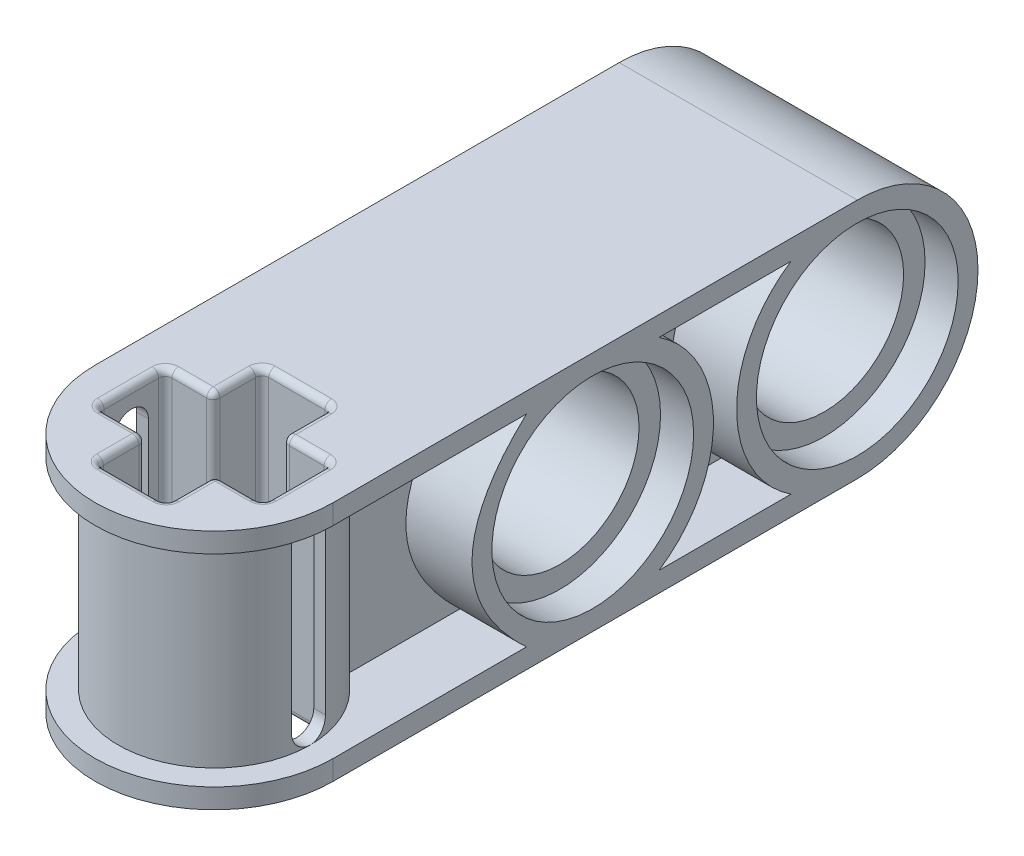
from build123d import *

# Parameters (mm, degrees)
SKETCH2_R           = 2.4
BOSS_EXTRUDE1_DEPTH = 7.2
CUT_EXTRUDE1_DEPTH  = 23.341721062
CUT_EXTRUDE2_START  = -7.3
CUT_EXTRUDE2_DEPTH  = 7.3
SKETCH5_R           = 3.05
CUT_EXTRUDE3_DEPTH  = 1
CUT_EXTRUDE4_START  = -1
SKETCH6_R           = 3.05
CUT_EXTRUDE4_DEPTH  = 1
CUT_EXTRUDE5_START  = -2
CUT_EXTRUDE5_DEPTH  = 2
CUT_EXTRUDE6_DEPTH  = 2
CUT_EXTRUDE10_DEPTH = 2
SKETCH13_W          = 1.9505477
SKETCH13_H          = 6.1
CUT_REVOLVE2_ANGLE  = 180
SKETCH13_3_W        = 1.9505477
SKETCH13_3_H        = 6.1
CUT_REVOLVE3_ANGLE  = 55
CUT_EXTRUDE11_DEPTH = 100
FILLET1_R           = 0.2


# Read off the part's stored shape, not the designer's step: Cut-Extrude2
with BuildPart() as part:
    # Sketch2 → Boss-Extrude1 (new body)
    with BuildSketch(Plane(origin=(0, 0, 0), x_dir=(0, 0, -1), z_dir=(1, 0, 0))):
        with BuildLine():
            Line((0, -3.65), (-19.85, -3.65))
            Line((-19.85, -3.65), (-19.85, 3.65))
            Line((-19.85, 3.65), (0, 3.65))
            ThreePointArc((0, 3.65), (3.65, 0), (0, -3.65))
        make_face()
        Circle(SKETCH2_R, mode=Mode.SUBTRACT)
        with Locations((-8, 0)):
            Circle(SKETCH2_R, mode=Mode.SUBTRACT)
    extrude(amount=BOSS_EXTRUDE1_DEPTH)

    # Sketch3 → Cut-Extrude1 (cut, through all)
    with BuildSketch(Plane(origin=(0, 3.65, 0), x_dir=(1, 0, 0), z_dir=(0, 1, 0))):
        Polygon((2.55, -14.825), (1.1, -14.825), (1.1, -16.875), (2.55, -16.875), (2.55, -18.35), (4.65, -18.35), (4.65, -16.875), (6.1, -16.875), (6.1, -14.825), (4.65, -14.825), (4.65, -13.35), (2.55, -13.35), align=None)
    extrude(amount=-CUT_EXTRUDE1_DEPTH, mode=Mode.SUBTRACT)

    # Cut-Extrude2 outline → Cut-Extrude2 (cut)
    with BuildSketch(Plane(origin=(0, 3.65, 0), x_dir=(1, 0, 0), z_dir=(0, 1, 0)).offset(CUT_EXTRUDE2_START)):
        with BuildLine():
            Line((7.2, -19.85), (7.2, -15.85))
            ThreePointArc((7.2, -15.85), (3.6, -19.45), (0, -15.85))
            Line((0, -15.85), (0, -19.85))
            Line((0, -19.85), (7.2, -19.85))
        make_face()
    extrude(amount=CUT_EXTRUDE2_DEPTH, mode=Mode.SUBTRACT)

    # Sketch5 → Cut-Extrude3 (cut)
    with BuildSketch(Plane(origin=(7.2, 0, 0), x_dir=(0, 0, -1), z_dir=(1, 0, 0))):
        with Locations((-8, 0)):
            Circle(SKETCH5_R)
        Circle(SKETCH5_R)
    extrude(amount=-CUT_EXTRUDE3_DEPTH, mode=Mode.SUBTRACT)

    # Sketch6 → Cut-Extrude4 (cut)
    with BuildSketch(Plane.ZY.offset(CUT_EXTRUDE4_START)):
        with Locations(Location((0, 0, 0), (0, 0, 180))):
            Circle(SKETCH6_R)
        with Locations(Location((8, 0, 0), (0, 0, 180))):
            Circle(SKETCH6_R)
    extrude(amount=CUT_EXTRUDE4_DEPTH, mode=Mode.SUBTRACT)

    # Sketch8 → Cut-Extrude5 (cut)
    with BuildSketch(Plane(origin=(7.2, 0, 0), x_dir=(0, 0, -1), z_dir=(1, 0, 0)).offset(CUT_EXTRUDE5_START)):
        with BuildLine():
            Line((-5.995006234, 3.05), (-2.004993766, 3.05))
            ThreePointArc((-2.004993766, 3.05), (-3.65, 0), (-2.004993766, -3.05))
            Line((-2.004993766, -3.05), (-5.995006234, -3.05))
            ThreePointArc((-5.995006234, -3.05), (-4.35, 0), (-5.995006234, 3.05))
        make_face()
    extrude(amount=CUT_EXTRUDE5_DEPTH, mode=Mode.SUBTRACT)

    # Sketch9 → Cut-Extrude6 (cut)
    with BuildSketch(Plane.ZY):
        with BuildLine():
            Line((2.004993766, 3.05), (5.995006234, 3.05))
            ThreePointArc((5.995006234, 3.05), (4.35, 0), (5.995006234, -3.05))
            Line((5.995006234, -3.05), (2.004993766, -3.05))
            ThreePointArc((2.004993766, -3.05), (3.65, 0), (2.004993766, 3.05))
        make_face()
    extrude(amount=-CUT_EXTRUDE6_DEPTH, mode=Mode.SUBTRACT)

    # Sketch15 → Cut-Extrude10 (cut)
    with BuildSketch(Plane(origin=(7.2, 0, 0), x_dir=(0, 0, -1), z_dir=(1, 0, 0))):
        with BuildLine():
            add(Edge.make_bspline(
                [(-10.004993766, 3.05), (-13.295006234, 0), (-10.004993766, -3.05)],
                knots=[0, 0, 0, 1, 1, 1], degree=2))
            Line((-10.004993766, -3.05), (-13.477577885, -3.05))
            Line((-13.477577885, -3.05), (-13.477577885, 3.05))
            Line((-13.477577885, 3.05), (-10.004993766, 3.05))
        make_face()
    cut_extrude10 = extrude(amount=-CUT_EXTRUDE10_DEPTH, mode=Mode.SUBTRACT)

    # Sketch13 → Cut-Revolve2 (revolve, cut)
    with BuildSketch(Plane.XY.offset(15.85)):
        with Locations((7.47527385, 0)):
            Rectangle(SKETCH13_W, SKETCH13_H)
    revolve(axis=Axis((3.6, 3.65, 15.85), (0, -1, 0)), revolution_arc=CUT_REVOLVE2_ANGLE, mode=Mode.SUBTRACT)

    # Sketch13<3> → Cut-Revolve3 (revolve, cut)
    with BuildSketch(Plane.XY.offset(15.85)):
        with Locations((7.47527385, 0)):
            Rectangle(SKETCH13_3_W, SKETCH13_3_H)
    cut_revolve3 = revolve(axis=Axis((3.6, 3.65, 15.85), (0, 1, 0)), revolution_arc=CUT_REVOLVE3_ANGLE, mode=Mode.SUBTRACT)

    # Mirror2: Cut-Revolve3 across plane
    add(cut_revolve3.mirror(Plane.ZY.offset(-3.6)), mode=Mode.SUBTRACT)

    # Mirror3: Cut-Extrude10 across plane
    add(cut_extrude10.mirror(Plane.ZY.offset(-3.6)), mode=Mode.SUBTRACT)

    # Sketch16 → Cut-Extrude11 (cut, symmetric)
    with BuildSketch(Plane.ZY.offset(-6.1)):
        with BuildLine():
            Line((16.36309696, 2.53690304), (16.36309696, -2.53690304))
            ThreePointArc((16.36309696, -2.53690304), (15.85, -3.05), (15.33690304, -2.53690304))
            Line((15.33690304, -2.53690304), (15.33690304, 2.53690304))
            ThreePointArc((15.33690304, 2.53690304), (15.85, 3.05), (16.36309696, 2.53690304))
        make_face()
    extrude(amount=CUT_EXTRUDE11_DEPTH, both=True, mode=Mode.SUBTRACT)

    # Fillet1
    fillet1_edges = [part.edges().sort_by_distance(p)[0] for p in [
        (2.55, -3.65, 14.0875),
        (2.55, 0, 14.825),
        (3.6, -3.65, 13.35),
        (2.55, 0, 13.35),
        (4.65, -3.65, 14.0875),
        (4.65, 0, 13.35),
        (5.375, -3.65, 14.825),
        (4.65, 0, 14.825),
        (6.1, -3.65, 15.85),
        (6.1, 0, 14.825),
        (5.375, -3.65, 16.875),
        (6.1, 0, 16.875),
        (4.65, -3.65, 17.6125),
        (4.65, 0, 16.875),
        (3.6, -3.65, 18.35),
        (4.65, 0, 18.35),
        (2.55, -3.65, 17.6125),
        (2.55, 0, 18.35),
        (1.825, -3.65, 16.875),
        (2.55, 0, 16.875),
        (1.1, -3.65, 15.85),
        (1.1, 0, 16.875),
        (1.825, -3.65, 14.825),
        (1.1, 0, 14.825),
        (2.55, 3.65, 14.0875),
        (1.825, 3.65, 14.825),
        (1.1, 3.65, 15.85),
        (1.825, 3.65, 16.875),
        (2.55, 3.65, 17.6125),
        (3.6, 3.65, 18.35),
        (4.65, 3.65, 17.6125),
        (5.375, 3.65, 16.875),
        (6.1, 3.65, 15.85),
        (5.375, 3.65, 14.825),
        (4.65, 3.65, 14.0875),
        (3.6, 3.65, 13.35),
    ]]
    fillet(fillet1_edges, radius=FILLET1_R)


solid = part.part
